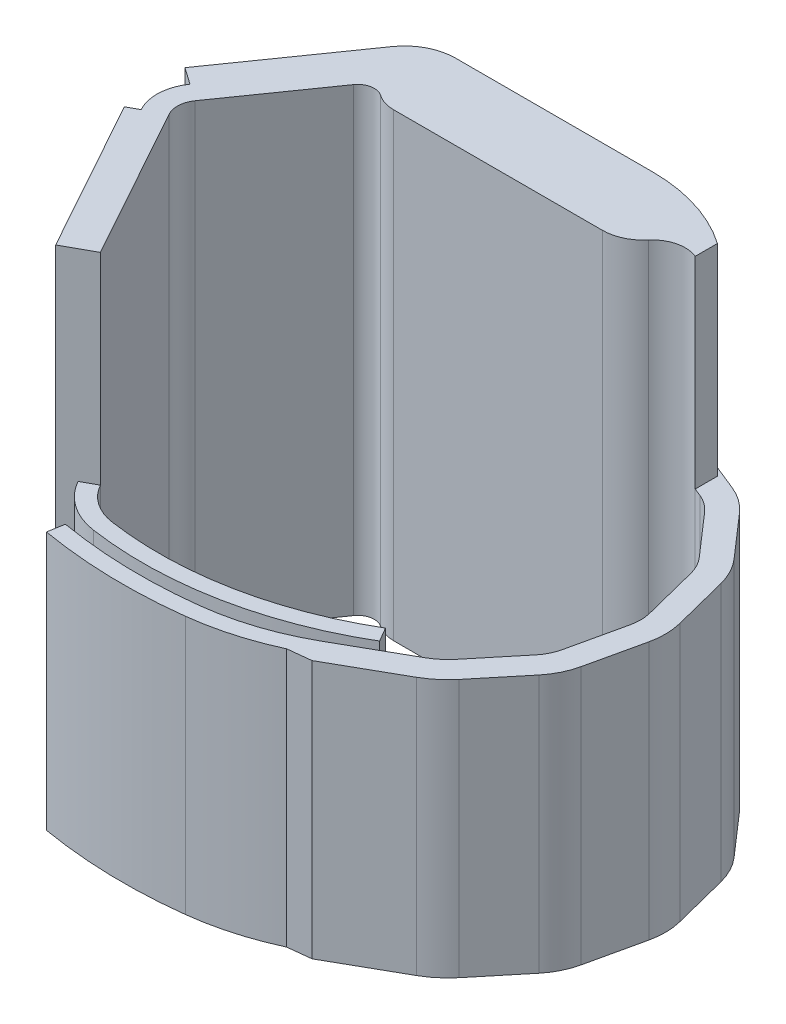
from build123d import *

# Parameters (mm, degrees)
BOSS_EXTRUDE1_DEPTH = 23.4
FILLET1_R           = 4
FILLET3_R           = 2
FILLET4_R           = 4
FILLET5_R           = 5
BOSS_EXTRUDE2_DEPTH = 24.5
BOSS_EXTRUDE3_START = 8
SKETCH3_R           = 0.75
BOSS_EXTRUDE3_DEPTH = 8


with BuildPart() as part:
    # Sketch1 → Boss-Extrude1 (new body)
    with BuildSketch(Plane(origin=(0, 0, 0), x_dir=(1, 0, 0), z_dir=(0, 1, 0))):
        with BuildLine():
            Line((0, 0), (30, 0))
            Line((30, 0), (30, 5.1))
            Line((30, 5.1), (36.395958363, 2.511232605))
            ThreePointArc((36.395958363, 2.511232605), (37.463728778, 1.925417586), (38.366240646, 1.107624688))
            Line((38.366240646, 1.107624688), (42.902523658, -4.091619145))
            ThreePointArc((42.902523658, -4.091619145), (43.590417547, -5.096663868), (44.026071732, -6.233993339))
            Line((44.026071732, -6.233993339), (45.723869414, -12.921854211))
            ThreePointArc((45.723869414, -12.921854211), (45.883457457, -14.129266548), (45.7582513, -15.340726954))
            Line((45.7582513, -15.340726954), (44.251223786, -22.074141249))
            ThreePointArc((44.251223786, -22.074141249), (43.848071102, -23.223393532), (43.189020782, -24.247583736))
            Line((43.189020782, -24.247583736), (38.802344779, -29.573658617))
            ThreePointArc((38.802344779, -29.573658617), (37.883123065, -30.501625481), (36.810104599, -31.246422387))
            Line((36.810104599, -31.246422387), (28.716751538, -35.827648886))
            ThreePointArc((28.716751538, -35.827648886), (23.339920043, -38.206219709), (17.601311476, -39.485394366))
            ThreePointArc((17.601311476, -39.485394366), (9.20703571, -39.890619172), (0.842295428, -39.078712278))
            Line((0.842295428, -39.078712278), (0.505393215, -41.050132299))
            ThreePointArc((0.505393215, -41.050132299), (9.158517062, -41.89003057), (17.842194661, -41.470835196))
            ThreePointArc((17.842194661, -41.470835196), (22.730520814, -40.484713163), (27.40515094, -38.748048996))
            Line((27.40515094, -38.748048996), (30.194566538, -38.438407937))
            Line((30.194566538, -38.438407937), (38.287919599, -33.857181439))
            ThreePointArc((38.287919599, -33.857181439), (39.812213821, -32.79914781), (41.11802951, -31.480909053))
            Line((41.11802951, -31.480909053), (45.504705513, -26.154834172))
            ThreePointArc((45.504705513, -26.154834172), (46.543404661, -24.540654707), (47.178795219, -22.729370603))
            Line((47.178795219, -22.729370603), (48.685822733, -15.995956308))
            ThreePointArc((48.685822733, -15.995956308), (48.883154446, -14.086628819), (48.63163501, -12.183681305))
            Line((48.63163501, -12.183681305), (46.933837328, -5.495820434))
            ThreePointArc((46.933837328, -5.495820434), (46.247222637, -3.703327329), (45.163064455, -2.119322184))
            Line((45.163064455, -2.119322184), (40.626781443, 3.07992165))
            ThreePointArc((40.626781443, 3.07992165), (39.204373652, 4.368807735), (37.521509404, 5.292084068))
            Line((37.521509404, 5.292084068), (31.475993381, 7.739009747))
            ThreePointArc((31.475993381, 7.739009747), (27.794609995, 8.831354958), (23.972319774, 9.2))
            Line((23.972319774, 9.2), (0, 9.2))
            ThreePointArc((0, 9.2), (-2.867725571, 8.498272017), (-5.087407296, 6.551663389))
            Line((-5.087407296, 6.551663389), (-15.452573661, -8.251328295))
            Line((-15.452573661, -8.251328295), (-13.40469355, -9.685269386))
            ThreePointArc((-13.40469355, -9.685269386), (-14.36147987, -12.463471121), (-13.70098006, -15.326613615))
            Line((-13.70098006, -15.326613615), (-15.013073156, -16.053532941))
            Line((-15.013073156, -16.053532941), (-4.642357438, -34.772727782))
            Line((-4.642357438, -34.772727782), (-2.892899976, -33.803502014))
            ThreePointArc((-2.892899976, -33.803502014), (-0.356026186, -36.605109272), (3.160716272, -37.98975881))
            ThreePointArc((3.160716272, -37.98975881), (18.191080341, -37.623613679), (32.244088475, -32.279563836))
            Line((32.244088475, -32.279563836), (31.228009552, -30.556896247))
            ThreePointArc((31.228009552, -30.556896247), (17.805759331, -35.661082732), (3.450021006, -36.010793734))
            ThreePointArc((3.450021006, -36.010793734), (0.781528732, -34.960126351), (-1.143442514, -32.834276246))
            Line((-1.143442514, -32.834276246), (-11.514158233, -14.115081405))
            ThreePointArc((-11.514158233, -14.115081405), (-11.864920764, -12.594591782), (-11.35681344, -11.119210477))
            Line((-11.35681344, -11.119210477), (0, 5.1))
            Line((0, 5.1), (0, 0))
        make_face()
    extrude(amount=BOSS_EXTRUDE1_DEPTH)

    # Fillet1
    # the kernel refuses this fillet: 4 mm, written as the material it adds along each edge
    with BuildSketch(Plane(origin=(30, 0, -5.1), x_dir=(0, 0, 1), z_dir=(0, 1, 0))) as fillet1_piece_1:
        with BuildLine():
            CenterArc((5.901400798, 3.918897391), FILLET1_R, 157.964334143, 100.478227364)
            Line((2.193598849, 5.419632112), (2.11944281, 5.449646807))
            Line((2.11944281, 5.449646807), (-0.074156039, 0.030014694))
            Line((-0.074156039, 0.030014694), (0, -0.08))
            ThreePointArc((0, -0.08), (2.55, -0.08), (5.083971984, -0.078377948))
            Line((5.083971984, -0.078377948), (5.1, 0))
        make_face()
    extrude(amount=23.4)

    # Fillet3
    # the kernel refuses this fillet: 2 mm, written as the material it adds along each edge
    with BuildSketch(Plane(origin=(0, 0, -5.1), x_dir=(0, 0, 1), z_dir=(0, 1, 0))) as fillet3_piece_1:
        with BuildLine():
            CenterArc((6.021753736, -1.774928182), FILLET3_R, 117.443704679, 117.556295321)
            Line((4.874600863, -3.41323227), (4.851657806, -3.445998352))
            Line((4.851657806, -3.445998352), (-0.022943057, -0.032766082))
            Line((-0.022943057, -0.032766082), (0, 0.04))
            ThreePointArc((0, 0.04), (2.55, 0.04), (5.081564925, 0.035498564))
            Line((5.081564925, 0.035498564), (5.1, 0))
        make_face()
    extrude(amount=23.4)

    # Fillet4
    fillet4_edges = [part.edges().sort_by_distance(p)[0] for p in [
        (0, 11.7, 0),
    ]]
    fillet(fillet4_edges, radius=FILLET4_R)

    # Fillet5
    fillet5_edges = [part.edges().sort_by_distance(p)[0] for p in [
        (30, 11.7, 0),
    ]]
    fillet(fillet5_edges, radius=FILLET5_R)

    # Sketch2 → Boss-Extrude2 (add)
    with BuildSketch(Plane(origin=(0, 23.4, 0), x_dir=(1, 0, 0), z_dir=(0, 1, 0))):
        with BuildLine():
            Line((-4.642357438, -34.772727782), (-2.892899976, -33.803502014))
            Line((-2.892899976, -33.803502014), (-1.143442514, -32.834276246))
            Line((-1.143442514, -32.834276246), (-11.514158233, -14.115081405))
            ThreePointArc((-11.514158233, -14.115081405), (-11.864920764, -12.594591782), (-11.35681344, -11.119210477))
            Line((-11.35681344, -11.119210477), (-3.41323227, 0.225399137))
            ThreePointArc((-3.41323227, 0.225399137), (-2.124184908, 1.047515098), (-0.631039096, 0.718830843))
            ThreePointArc((-0.631039096, 0.718830843), (0.457713769, 0.183936804), (1.656739075, 0))
            Line((1.656739075, 0), (27.038218008, 0))
            ThreePointArc((27.038218008, 0), (29.145941635, 0.465961942), (30.860817665, 1.776999556))
            ThreePointArc((30.860817665, 1.776999556), (32.957014936, 3.081224878), (35.419632112, 2.906401151))
            Line((35.419632112, 2.906401151), (35.419632112, 5.599970739))
            ThreePointArc((35.419632112, 5.599970739), (33.507981211, 6.780419817), (31.475993381, 7.739009747))
            ThreePointArc((31.475993381, 7.739009747), (27.794609995, 8.831354958), (23.972319774, 9.2))
            Line((23.972319774, 9.2), (0, 9.2))
            ThreePointArc((0, 9.2), (-2.867725571, 8.498272017), (-5.087407296, 6.551663389))
            Line((-5.087407296, 6.551663389), (-15.452573661, -8.251328295))
            Line((-15.452573661, -8.251328295), (-13.40469355, -9.685269386))
            ThreePointArc((-13.40469355, -9.685269386), (-14.36147987, -12.463471121), (-13.70098006, -15.326613615))
            Line((-13.70098006, -15.326613615), (-15.013073156, -16.053532941))
            Line((-15.013073156, -16.053532941), (-4.642357438, -34.772727782))
        make_face()
    extrude(amount=BOSS_EXTRUDE2_DEPTH)

    # Sketch3 → Boss-Extrude3 (add)
    with BuildSketch(Plane.XZ.offset(BOSS_EXTRUDE3_START)):
        with BuildLine():
            Line((27.038218008, 0), (1.656739075, 0))
            ThreePointArc((1.656739075, 0), (0.457713769, -0.183936804), (-0.631039096, -0.718830843))
            ThreePointArc((-0.631039096, -0.718830843), (-2.124184908, -1.047515098), (-3.41323227, -0.225399137))
            Line((-3.41323227, -0.225399137), (-11.35681344, 11.119210477))
            ThreePointArc((-11.35681344, 11.119210477), (-11.864920764, 12.594591782), (-11.514158233, 14.115081405))
            Line((-11.514158233, 14.115081405), (-1.143442514, 32.834276246))
            ThreePointArc((-1.143442514, 32.834276246), (0.781528732, 34.960126351), (3.450021006, 36.010793734))
            ThreePointArc((3.450021006, 36.010793734), (17.805759331, 35.661082732), (31.228009552, 30.556896247))
            Line((31.228009552, 30.556896247), (32.244088475, 32.279563836))
            ThreePointArc((32.244088475, 32.279563836), (18.191080341, 37.623613679), (3.160716272, 37.98975881))
            ThreePointArc((3.160716272, 37.98975881), (-0.356026186, 36.605109272), (-2.892899976, 33.803502014))
            Line((-2.892899976, 33.803502014), (-4.642357438, 34.772727782))
            Line((-4.642357438, 34.772727782), (-15.013073156, 16.053532941))
            Line((-15.013073156, 16.053532941), (-13.70098006, 15.326613615))
            ThreePointArc((-13.70098006, 15.326613615), (-14.36147987, 12.463471121), (-13.40469355, 9.685269386))
            Line((-13.40469355, 9.685269386), (-15.452573661, 8.251328295))
            Line((-15.452573661, 8.251328295), (-5.087407296, -6.551663389))
            ThreePointArc((-5.087407296, -6.551663389), (-2.867725571, -8.498272017), (0, -9.2))
            Line((0, -9.2), (23.972319774, -9.2))
            ThreePointArc((23.972319774, -9.2), (27.794609995, -8.831354958), (31.475993381, -7.739009747))
            Line((31.475993381, -7.739009747), (37.521509404, -5.292084068))
            ThreePointArc((37.521509404, -5.292084068), (39.204373652, -4.368807735), (40.626781443, -3.07992165))
            Line((40.626781443, -3.07992165), (45.163064455, 2.119322184))
            ThreePointArc((45.163064455, 2.119322184), (46.247222637, 3.703327329), (46.933837328, 5.495820434))
            Line((46.933837328, 5.495820434), (48.63163501, 12.183681305))
            ThreePointArc((48.63163501, 12.183681305), (48.883154446, 14.086628819), (48.685822733, 15.995956308))
            Line((48.685822733, 15.995956308), (47.178795219, 22.729370603))
            ThreePointArc((47.178795219, 22.729370603), (46.543404661, 24.540654707), (45.504705513, 26.154834172))
            Line((45.504705513, 26.154834172), (41.11802951, 31.480909053))
            ThreePointArc((41.11802951, 31.480909053), (39.812213821, 32.79914781), (38.287919599, 33.857181439))
            Line((38.287919599, 33.857181439), (30.194566538, 38.438407937))
            Line((30.194566538, 38.438407937), (27.40515094, 38.748048996))
            ThreePointArc((27.40515094, 38.748048996), (22.730520814, 40.484713163), (17.842194661, 41.470835196))
            ThreePointArc((17.842194661, 41.470835196), (9.158517062, 41.89003057), (0.505393215, 41.050132299))
            Line((0.505393215, 41.050132299), (0.842295428, 39.078712278))
            ThreePointArc((0.842295428, 39.078712278), (9.20703571, 39.890619172), (17.601311476, 39.485394366))
            ThreePointArc((17.601311476, 39.485394366), (23.339920043, 38.206219709), (28.716751538, 35.827648886))
            Line((28.716751538, 35.827648886), (36.810104599, 31.246422387))
            ThreePointArc((36.810104599, 31.246422387), (37.883123065, 30.501625481), (38.802344779, 29.573658617))
            Line((38.802344779, 29.573658617), (43.189020782, 24.247583736))
            ThreePointArc((43.189020782, 24.247583736), (43.848071102, 23.223393532), (44.251223786, 22.074141249))
            Line((44.251223786, 22.074141249), (45.7582513, 15.340726954))
            ThreePointArc((45.7582513, 15.340726954), (45.883457457, 14.129266548), (45.723869414, 12.921854211))
            Line((45.723869414, 12.921854211), (44.026071732, 6.233993339))
            ThreePointArc((44.026071732, 6.233993339), (43.590417547, 5.096663868), (42.902523658, 4.091619145))
            Line((42.902523658, 4.091619145), (38.366240646, -1.107624688))
            ThreePointArc((38.366240646, -1.107624688), (37.463728778, -1.925417586), (36.395958363, -2.511232605))
            Line((36.395958363, -2.511232605), (35.419632112, -2.906401151))
            ThreePointArc((35.419632112, -2.906401151), (32.957014936, -3.081224878), (30.860817665, -1.776999556))
            ThreePointArc((30.860817665, -1.776999556), (29.145941635, -0.465961942), (27.038218008, 0))
        make_face()
        with Locations(Location((-4.310418078, 30.709245073, 0), (0, 0, 270))):
            Circle(SKETCH3_R, mode=Mode.SUBTRACT)
        with Locations(Location((32.111644804, 35.612363227, 0), (0, 0, 270))):
            Circle(SKETCH3_R, mode=Mode.SUBTRACT)
        with Locations(Location((14.004070921, -5.292084068, 0), (0, 0, 270))):
            Circle(SKETCH3_R, mode=Mode.SUBTRACT)
    extrude(amount=-BOSS_EXTRUDE3_DEPTH)


solid = part.part
